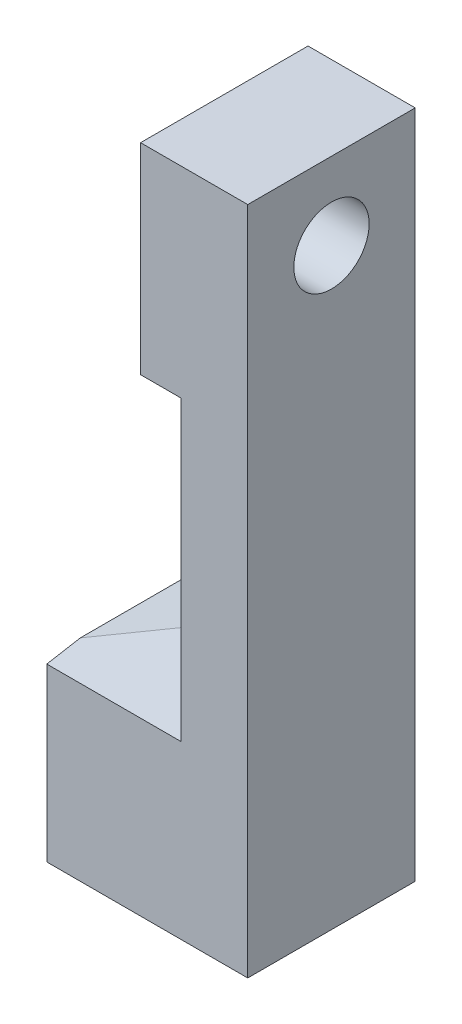
from build123d import *

# Parameters (mm, degrees)
SKETCH1_W               = 15.875
SKETCH1_H               = 63.5
BOSS_EXTRUDE1_DEPTH     = 6.35
BOSS_EXTRUDE2_DEPTH     = 3.81
BOSS_EXTRUDE3_DEPTH     = 12.7
CUT_EXTRUDE1_DEPTH      = 38.701036126
F_1_4_CLEARANCE_HOLE1_D = 7.14248


with BuildPart() as part:
    # Sketch1 → Boss-Extrude1 (new body)
    with BuildSketch(Plane(origin=(0, 0, 0), x_dir=(0, 0, -1), z_dir=(1, 0, 0))):
        Rectangle(SKETCH1_W, SKETCH1_H)
    extrude(amount=BOSS_EXTRUDE1_DEPTH)

    # Sketch2 → Boss-Extrude2 (add)
    with BuildSketch(Plane.ZY):
        Polygon((7.9375, 31.75), (-7.9375, 31.75), (-7.9375, 15.499190819), (7.9375, 12.7), align=None)
    extrude(amount=BOSS_EXTRUDE2_DEPTH)

    # Sketch3 → Boss-Extrude3 (add)
    with BuildSketch(Plane.ZY):
        Polygon((-7.9375, -12.7), (-7.9375, -31.75), (7.9375, -31.75), (7.9375, -15.499190819), align=None)
    extrude(amount=BOSS_EXTRUDE3_DEPTH)

    # Sketch6 → Cut-Extrude1 (cut, through all)
    with BuildSketch(Plane(origin=(0, 0, -7.9375), x_dir=(-1, 0, 0), z_dir=(0, 0, -1))):
        Polygon((0, -12.7), (12.7, -12.7), (12.7, -14.939352655), align=None)
    extrude(amount=-CUT_EXTRUDE1_DEPTH, mode=Mode.SUBTRACT)

    # 1/4 Clearance Hole1 (through all)
    with Locations(Plane(origin=(6.35, 0, 0), x_dir=(0, 0, -1), z_dir=(1, 0, 0))):
        with Locations((0, 24.416329786)):
            Hole(F_1_4_CLEARANCE_HOLE1_D / 2)


solid = part.part
